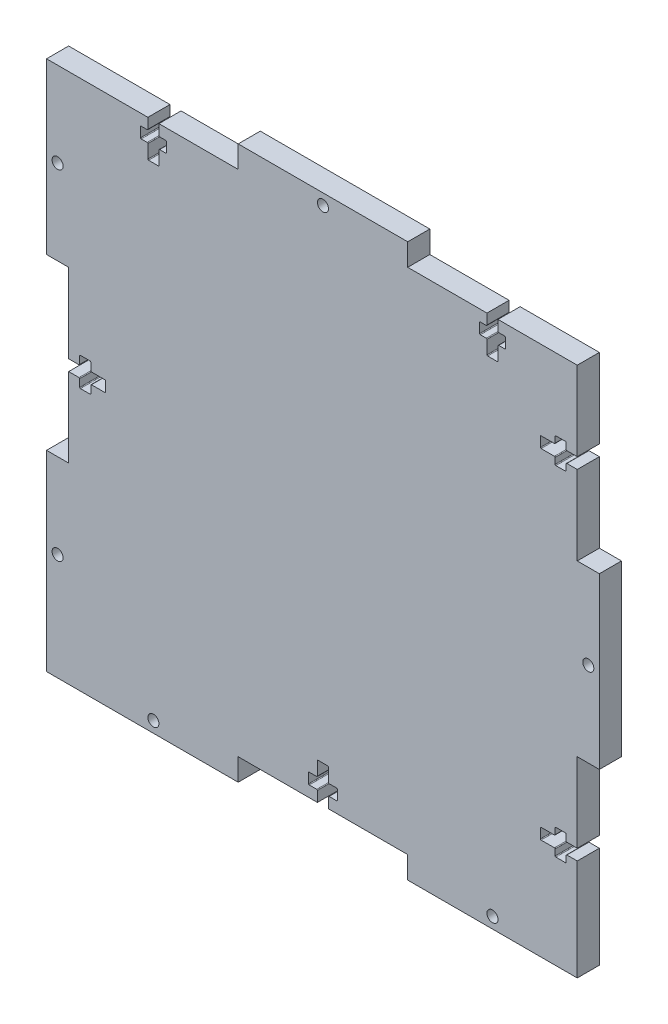
from build123d import *

# Parameters (mm, degrees)
BOX_SIDE_DEPTH       = 6
SKETCH2_R            = 1.5
SCREW_CUT_OUTS_DEPTH = 107.235587258
SKETCH3_W            = 6
SKETCH3_H            = 6
BOSS_EXTRUDE2_DEPTH  = 6


with BuildPart() as part:
    # Sketch1 → Box Side (new body)
    with BuildSketch(Plane.XY):
        Polygon((-69, 69), (-23, 69), (-23, 75), (23, 75), (23, 69), (69, 69), (69, 23), (75, 23), (75, -23), (69, -23), (69, -69), (69, -75), (23, -75), (23, -69), (-23, -69), (-23, -75), (-69, -75), (-69, -69), (-75, -69), (-75, -23), (-69, -23), (-69, 23), (-75, 23), (-75, 69), align=None)
    extrude(amount=BOX_SIDE_DEPTH)

    # Sketch2 → Screw Cut-outs (cut, through all)
    with BuildSketch(Plane.XY.offset(6)):
        with Locations((0, 72)):
            Circle(SKETCH2_R)
        with Locations((72, 0)):
            Circle(SKETCH2_R)
        with Locations((-46, -72)):
            Circle(SKETCH2_R)
        with Locations((46, -72)):
            Circle(SKETCH2_R)
        with Locations((-72, 46)):
            Circle(SKETCH2_R)
        with Locations((-72, -46)):
            Circle(SKETCH2_R)
        with BuildLine():
            Line((-44.5, 69), (-44.5, 66.2))
            ThreePointArc((-44.5, 66.2), (-44.441421356, 66.058578644), (-44.3, 66))
            Line((-44.3, 66), (-42.7, 66))
            ThreePointArc((-42.7, 66), (-42.558578644, 65.941421356), (-42.5, 65.8))
            Line((-42.5, 65.8), (-42.5, 63.2))
            ThreePointArc((-42.5, 63.2), (-42.558578644, 63.058578644), (-42.7, 63))
            Line((-42.7, 63), (-44.3, 63))
            ThreePointArc((-44.3, 63), (-44.441421356, 62.941421356), (-44.5, 62.8))
            Line((-44.5, 62.8), (-44.5, 59.2))
            ThreePointArc((-44.5, 59.2), (-44.558578644, 59.058578644), (-44.7, 59))
            Line((-44.7, 59), (-47.3, 59))
            ThreePointArc((-47.3, 59), (-47.441421356, 59.058578644), (-47.5, 59.2))
            Line((-47.5, 59.2), (-47.5, 62.8))
            ThreePointArc((-47.5, 62.8), (-47.558578644, 62.941421356), (-47.7, 63))
            Line((-47.7, 63), (-49.3, 63))
            ThreePointArc((-49.3, 63), (-49.441421356, 63.058578644), (-49.5, 63.2))
            Line((-49.5, 63.2), (-49.5, 65.8))
            ThreePointArc((-49.5, 65.8), (-49.441421356, 65.941421356), (-49.3, 66))
            Line((-49.3, 66), (-47.7, 66))
            ThreePointArc((-47.7, 66), (-47.558578644, 66.058578644), (-47.5, 66.2))
            Line((-47.5, 66.2), (-47.5, 69))
            Line((-47.5, 69), (-44.5, 69))
        make_face()
        with BuildLine():
            Line((47.5, 69), (47.5, 66.2))
            ThreePointArc((47.5, 66.2), (47.558578644, 66.058578644), (47.7, 66))
            Line((47.7, 66), (49.3, 66))
            ThreePointArc((49.3, 66), (49.441421356, 65.941421356), (49.5, 65.8))
            Line((49.5, 65.8), (49.5, 63.2))
            ThreePointArc((49.5, 63.2), (49.441421356, 63.058578644), (49.3, 63))
            Line((49.3, 63), (47.7, 63))
            ThreePointArc((47.7, 63), (47.558578644, 62.941421356), (47.5, 62.8))
            Line((47.5, 62.8), (47.5, 59.2))
            ThreePointArc((47.5, 59.2), (47.441421356, 59.058578644), (47.3, 59))
            Line((47.3, 59), (44.7, 59))
            ThreePointArc((44.7, 59), (44.558578644, 59.058578644), (44.5, 59.2))
            Line((44.5, 59.2), (44.5, 62.8))
            ThreePointArc((44.5, 62.8), (44.441421356, 62.941421356), (44.3, 63))
            Line((44.3, 63), (42.7, 63))
            ThreePointArc((42.7, 63), (42.558578644, 63.058578644), (42.5, 63.2))
            Line((42.5, 63.2), (42.5, 65.8))
            ThreePointArc((42.5, 65.8), (42.558578644, 65.941421356), (42.7, 66))
            Line((42.7, 66), (44.3, 66))
            ThreePointArc((44.3, 66), (44.441421356, 66.058578644), (44.5, 66.2))
            Line((44.5, 66.2), (44.5, 69))
            Line((44.5, 69), (47.5, 69))
        make_face()
        with BuildLine():
            Line((69, 44.5), (66.2, 44.5))
            ThreePointArc((66.2, 44.5), (66.058578644, 44.441421356), (66, 44.3))
            Line((66, 44.3), (66, 42.7))
            ThreePointArc((66, 42.7), (65.941421356, 42.558578644), (65.8, 42.5))
            Line((65.8, 42.5), (63.2, 42.5))
            ThreePointArc((63.2, 42.5), (63.058578644, 42.558578644), (63, 42.7))
            Line((63, 42.7), (63, 44.3))
            ThreePointArc((63, 44.3), (62.941421356, 44.441421356), (62.8, 44.5))
            Line((62.8, 44.5), (59.2, 44.5))
            ThreePointArc((59.2, 44.5), (59.058578644, 44.558578644), (59, 44.7))
            Line((59, 44.7), (59, 47.3))
            ThreePointArc((59, 47.3), (59.058578644, 47.441421356), (59.2, 47.5))
            Line((59.2, 47.5), (62.8, 47.5))
            ThreePointArc((62.8, 47.5), (62.941421356, 47.558578644), (63, 47.7))
            Line((63, 47.7), (63, 49.3))
            ThreePointArc((63, 49.3), (63.058578644, 49.441421356), (63.2, 49.5))
            Line((63.2, 49.5), (65.8, 49.5))
            ThreePointArc((65.8, 49.5), (65.941421356, 49.441421356), (66, 49.3))
            Line((66, 49.3), (66, 47.7))
            ThreePointArc((66, 47.7), (66.058578644, 47.558578644), (66.2, 47.5))
            Line((66.2, 47.5), (69, 47.5))
            Line((69, 47.5), (69, 44.5))
        make_face()
        with BuildLine():
            Line((69, -47.5), (66.2, -47.5))
            ThreePointArc((66.2, -47.5), (66.058578644, -47.558578644), (66, -47.7))
            Line((66, -47.7), (66, -49.3))
            ThreePointArc((66, -49.3), (65.941421356, -49.441421356), (65.8, -49.5))
            Line((65.8, -49.5), (63.2, -49.5))
            ThreePointArc((63.2, -49.5), (63.058578644, -49.441421356), (63, -49.3))
            Line((63, -49.3), (63, -47.7))
            ThreePointArc((63, -47.7), (62.941421356, -47.558578644), (62.8, -47.5))
            Line((62.8, -47.5), (59.2, -47.5))
            ThreePointArc((59.2, -47.5), (59.058578644, -47.441421356), (59, -47.3))
            Line((59, -47.3), (59, -44.7))
            ThreePointArc((59, -44.7), (59.058578644, -44.558578644), (59.2, -44.5))
            Line((59.2, -44.5), (62.8, -44.5))
            ThreePointArc((62.8, -44.5), (62.941421356, -44.441421356), (63, -44.3))
            Line((63, -44.3), (63, -42.7))
            ThreePointArc((63, -42.7), (63.058578644, -42.558578644), (63.2, -42.5))
            Line((63.2, -42.5), (65.8, -42.5))
            ThreePointArc((65.8, -42.5), (65.941421356, -42.558578644), (66, -42.7))
            Line((66, -42.7), (66, -44.3))
            ThreePointArc((66, -44.3), (66.058578644, -44.441421356), (66.2, -44.5))
            Line((66.2, -44.5), (69, -44.5))
            Line((69, -44.5), (69, -47.5))
        make_face()
        with BuildLine():
            Line((-1.5, -69), (1.5, -69))
            Line((1.5, -69), (1.5, -66.2))
            ThreePointArc((1.5, -66.2), (1.558578644, -66.058578644), (1.7, -66))
            Line((1.7, -66), (3.7, -66))
            ThreePointArc((3.7, -66), (3.841421356, -65.941421356), (3.9, -65.8))
            Line((3.9, -65.8), (3.9, -63.2))
            ThreePointArc((3.9, -63.2), (3.841421356, -63.058578644), (3.7, -63))
            Line((3.7, -63), (1.7, -63))
            ThreePointArc((1.7, -63), (1.558578644, -62.941421356), (1.5, -62.8))
            Line((1.5, -62.8), (1.5, -59.2))
            ThreePointArc((1.5, -59.2), (1.441421356, -59.058578644), (1.3, -59))
            Line((1.3, -59), (-1.3, -59))
            ThreePointArc((-1.3, -59), (-1.441421356, -59.058578644), (-1.5, -59.2))
            Line((-1.5, -59.2), (-1.5, -62.8))
            ThreePointArc((-1.5, -62.8), (-1.558578644, -62.941421356), (-1.7, -63))
            Line((-1.7, -63), (-3.7, -63))
            ThreePointArc((-3.7, -63), (-3.841421356, -63.058578644), (-3.9, -63.2))
            Line((-3.9, -63.2), (-3.9, -65.8))
            ThreePointArc((-3.9, -65.8), (-3.841421356, -65.941421356), (-3.7, -66))
            Line((-3.7, -66), (-1.7, -66))
            ThreePointArc((-1.7, -66), (-1.558578644, -66.058578644), (-1.5, -66.2))
            Line((-1.5, -66.2), (-1.5, -69))
        make_face()
        with BuildLine():
            Line((-69, -1.5), (-66.2, -1.5))
            ThreePointArc((-66.2, -1.5), (-66.058578644, -1.558578644), (-66, -1.7))
            Line((-66, -1.7), (-66, -3.7))
            ThreePointArc((-66, -3.7), (-65.941421356, -3.841421356), (-65.8, -3.9))
            Line((-65.8, -3.9), (-63.2, -3.9))
            ThreePointArc((-63.2, -3.9), (-63.058578644, -3.841421356), (-63, -3.7))
            Line((-63, -3.7), (-63, -1.7))
            ThreePointArc((-63, -1.7), (-62.941421356, -1.558578644), (-62.8, -1.5))
            Line((-62.8, -1.5), (-59.2, -1.5))
            ThreePointArc((-59.2, -1.5), (-59.058578644, -1.441421356), (-59, -1.3))
            Line((-59, -1.3), (-59, 1.3))
            ThreePointArc((-59, 1.3), (-59.058578644, 1.441421356), (-59.2, 1.5))
            Line((-59.2, 1.5), (-62.8, 1.5))
            ThreePointArc((-62.8, 1.5), (-62.941421356, 1.558578644), (-63, 1.7))
            Line((-63, 1.7), (-63, 3.7))
            ThreePointArc((-63, 3.7), (-63.058578644, 3.841421356), (-63.2, 3.9))
            Line((-63.2, 3.9), (-65.8, 3.9))
            ThreePointArc((-65.8, 3.9), (-65.941421356, 3.841421356), (-66, 3.7))
            Line((-66, 3.7), (-66, 1.7))
            ThreePointArc((-66, 1.7), (-66.058578644, 1.558578644), (-66.2, 1.5))
            Line((-66.2, 1.5), (-69, 1.5))
            Line((-69, 1.5), (-69, -1.5))
        make_face()
    extrude(amount=-SCREW_CUT_OUTS_DEPTH, mode=Mode.SUBTRACT)

    # Sketch3 → Boss-Extrude2 (add)
    with BuildSketch(Plane.XY.offset(6)):
        with Locations((-72, -72)):
            Rectangle(SKETCH3_W, SKETCH3_H)
    extrude(amount=-BOSS_EXTRUDE2_DEPTH)


solid = part.part
